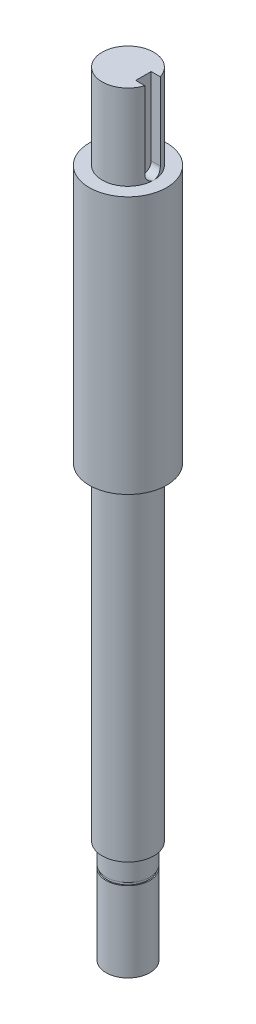
from build123d import *

# Parameters (mm, degrees)
CUT_EXTRUDE1_START = 6
CUT_EXTRUDE1_DEPTH = 271.814016986


with BuildPart() as part:
    # Sketch1 → Revolve1 (revolve)
    with BuildSketch(Plane(origin=(0, 0, 0), x_dir=(0, 0, -1), z_dir=(1, 0, 0))):
        Polygon((0, 24), (10, 24), (10, -9), (15, -9), (15, -109), (10, -109), (10, -236), (8.5, -236), (8.5, -243.9), (8.1, -243.9), (8.1, -245), (8.5, -245), (8.5, -276), (0, -276), align=None)
    revolve(axis=Axis((0, 24, 0), (0, -1, 0)))

    # Sketch2 → Cut-Extrude1 (cut, through all)
    with BuildSketch(Plane(origin=(0, 0, 0), x_dir=(0, 0, -1), z_dir=(1, 0, 0)).offset(CUT_EXTRUDE1_START)):
        with BuildLine():
            Line((3, 24), (3, -6))
            ThreePointArc((3, -6), (0, -9), (-3, -6))
            Line((-3, -6), (-3, 24))
            ThreePointArc((-3, 24), (0, 27), (3, 24))
        make_face()
    extrude(amount=CUT_EXTRUDE1_DEPTH, mode=Mode.SUBTRACT)


solid = part.part
